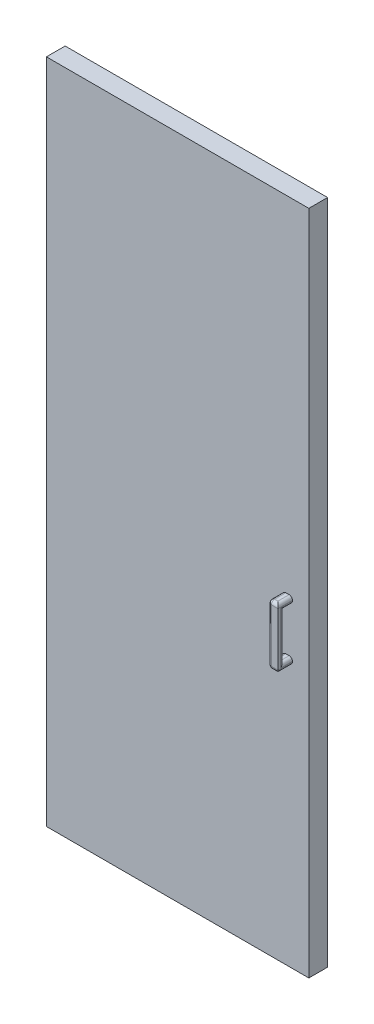
from build123d import *

# Parameters (mm, degrees)
BOSS_EXTRUDE2_DEPTH = 57.15
BOSS_EXTRUDE3_DEPTH = 44
CUT_EXTRUDE1_DEPTH  = 44
FILLET1_R           = 10
SKETCH6_W           = 120
SKETCH6_H           = 460.0000000000001
BOSS_EXTRUDE4_DEPTH = 10


with BuildPart() as part:
    # Sketch1 → Boss-Extrude2 (new body)
    with BuildSketch(Plane.XY):
        Polygon((0, 0), (0, 446.2018372120283), (-800, 446.2018372120282), (-799.9999999999998, -1585.7981627879717), (0, -1585.7981627879717), align=None)
    extrude(amount=BOSS_EXTRUDE2_DEPTH)

    # Sketch4 → Boss-Extrude3 (add)
    with BuildSketch(Plane.XY.offset(57.15)):
        Polygon((-79.99999999999993, -603.7981627879718), (-49.999999999999936, -603.7981627879718), (-49.999999999999915, -785.7981627879718), (-79.9999999999999, -785.7981627879718), align=None)
    extrude(amount=BOSS_EXTRUDE3_DEPTH)

    # Sketch5 → Cut-Extrude1 (cut)
    with BuildSketch(Plane.ZY.offset(80.00000000000003)):
        Polygon((83.14999999999999, -624.7981627879717), (57.150000000000006, -624.7981627879717), (57.15, -764.7981627879717), (83.15, -764.7981627879717), align=None)
    extrude(amount=-CUT_EXTRUDE1_DEPTH, mode=Mode.SUBTRACT)

    # Fillet1
    # the kernel refuses this fillet: 10 mm, written as the material it takes off along each edge
    with BuildSketch(Plane(origin=(-69.99999999999993, -613.7981627879718, 91.15), x_dir=(-1, -1.6e-16, 0), z_dir=(0, 1, 0))) as fillet1_piece_1_section:
        Polygon((0, 0), (FILLET1_R, 0), (FILLET1_R, FILLET1_R), (0, FILLET1_R), align=None)
    fillet1_piece_1 = extrude(amount=FILLET1_R, mode=Mode.PRIVATE)
    fillet1_piece_1 = fillet1_piece_1 - Plane(origin=(-69.99999999999993, -613.7981627879718, 91.15), x_dir=(0.7071067811865475, 0, -0.7071067811865475), z_dir=(0, 1, 0)) * Sphere(FILLET1_R, mode=Mode.PRIVATE)
    add(fillet1_piece_1, mode=Mode.SUBTRACT)
    with BuildSketch(Plane(origin=(-69.9999999999999, -775.7981627879718, 91.15), x_dir=(0, 0, 1), z_dir=(-1, -1.6e-16, 0))) as fillet1_piece_2_section:
        Polygon((0, 0), (FILLET1_R, 0), (FILLET1_R, -FILLET1_R), (0, -FILLET1_R), align=None)
    fillet1_piece_2 = extrude(amount=FILLET1_R, mode=Mode.PRIVATE)
    fillet1_piece_2 = fillet1_piece_2 - Plane(origin=(-69.9999999999999, -775.7981627879718, 91.15), x_dir=(0, 0.7071067811865475, -0.7071067811865475), z_dir=(-1, -1.6e-16, 0)) * Sphere(FILLET1_R, mode=Mode.PRIVATE)
    add(fillet1_piece_2, mode=Mode.SUBTRACT)
    with BuildSketch(Plane(origin=(-49.999999999999915, -785.7981627879718, 57.15), x_dir=(-1, 0, 0), z_dir=(0, 0, 1))) as fillet1_piece_3:
        with BuildLine():
            CenterArc((FILLET1_R, -FILLET1_R), FILLET1_R, 90, 90)
            Line((0, -FILLET1_R), (0, 0))
            Line((0, 0), (FILLET1_R, 0))
        make_face()
    extrude(amount=69, mode=Mode.SUBTRACT)
    with BuildSketch(Plane(origin=(-49.999999999999936, -603.7981627879718, 57.15), x_dir=(0, -1, 0), z_dir=(0, 0, 1))) as fillet1_piece_4:
        with BuildLine():
            CenterArc((FILLET1_R, -FILLET1_R), FILLET1_R, 90, 90)
            Line((0, -FILLET1_R), (0, 0))
            Line((0, 0), (FILLET1_R, 0))
        make_face()
    extrude(amount=69, mode=Mode.SUBTRACT)
    with BuildSketch(Plane(origin=(-79.99999999999993, -603.7981627879718, 57.15), x_dir=(1, 0, 0), z_dir=(0, 0, 1))) as fillet1_piece_5:
        with BuildLine():
            CenterArc((FILLET1_R, -FILLET1_R), FILLET1_R, 90, 90)
            Line((0, -FILLET1_R), (0, 0))
            Line((0, 0), (FILLET1_R, 0))
        make_face()
    extrude(amount=34.00000000000001, mode=Mode.SUBTRACT)
    with BuildSketch(Plane(origin=(-79.9999999999999, -785.7981627879718, 57.15), x_dir=(1, 0, 0), z_dir=(0, 0, 1))) as fillet1_piece_6:
        with BuildLine():
            CenterArc((FILLET1_R, FILLET1_R), FILLET1_R, 180, 90)
            Line((0, FILLET1_R), (0, 0))
            Line((0, 0), (FILLET1_R, 0))
        make_face()
    extrude(amount=34.00000000000001, mode=Mode.SUBTRACT)
    with BuildSketch(Plane(origin=(-69.99999999999993, -603.7981627879718, 101.15), x_dir=(0, 0, -1), z_dir=(1, 0, 0))) as fillet1_piece_7:
        with BuildLine():
            CenterArc((FILLET1_R, -FILLET1_R), FILLET1_R, 90, 90)
            Line((0, -FILLET1_R), (0, 0))
            Line((0, 0), (FILLET1_R, 0))
        make_face()
    extrude(amount=44.99999999999999, mode=Mode.SUBTRACT)
    with BuildSketch(Plane(origin=(-79.9999999999999, -775.7981627879718, 101.15), x_dir=(0, 0, -1), z_dir=(-1.6e-16, 1, 0))) as fillet1_piece_8:
        with BuildLine():
            CenterArc((FILLET1_R, -FILLET1_R), FILLET1_R, 90, 90)
            Line((0, -FILLET1_R), (0, 0))
            Line((0, 0), (FILLET1_R, 0))
        make_face()
    extrude(amount=162, mode=Mode.SUBTRACT)
    with BuildSketch(Plane(origin=(-24.999999999999915, -785.7981627879718, 101.15), x_dir=(0, 0, -1), z_dir=(-1, 0, 0))) as fillet1_piece_9:
        with BuildLine():
            CenterArc((FILLET1_R, -FILLET1_R), FILLET1_R, 90, 90)
            Line((0, -FILLET1_R), (0, 0))
            Line((0, 0), (FILLET1_R, 0))
        make_face()
    extrude(amount=44.999999999999986, mode=Mode.SUBTRACT)
    with BuildSketch(Plane(origin=(-79.99999999999991, -764.7981627879717, 57.15000000000002), x_dir=(1.42e-15, -1, 0), z_dir=(0, 0, 1))) as fillet1_piece_10:
        with BuildLine():
            CenterArc((FILLET1_R, FILLET1_R), FILLET1_R, 180, 89.99999999999989)
            Line((1.421e-14, FILLET1_R), (0, 0))
            Line((0, 0), (FILLET1_R, 0))
        make_face()
    extrude(amount=25.999999999999986, mode=Mode.SUBTRACT)
    with BuildSketch(Plane(origin=(-79.99999999999993, -624.7981627879717, 83.14999999999999), x_dir=(0, 1, 0), z_dir=(0, 0, -1))) as fillet1_piece_11:
        with BuildLine():
            CenterArc((FILLET1_R, FILLET1_R), FILLET1_R, 180, 90)
            Line((0, FILLET1_R), (0, 0))
            Line((0, 0), (FILLET1_R, 0))
        make_face()
    extrude(amount=25.999999999999986, mode=Mode.SUBTRACT)
    with BuildSketch(Plane(origin=(-79.99999999999991, -764.7981627879717, 83.15), x_dir=(1.42e-15, 1e-16, 1), z_dir=(-1.5e-16, 1, -1e-16))) as fillet1_piece_12:
        with BuildLine():
            CenterArc((FILLET1_R, FILLET1_R), FILLET1_R, 180, 89.99999999999989)
            Line((1.421e-14, FILLET1_R), (0, 0))
            Line((0, 0), (FILLET1_R, 0))
        make_face()
    extrude(amount=140, mode=Mode.SUBTRACT)
    with BuildSketch(Plane(origin=(-49.999999999999915, -764.7981627879717, 83.15), x_dir=(0, -1, 0), z_dir=(0, 0, -1))) as fillet1_piece_13:
        with BuildLine():
            CenterArc((FILLET1_R, FILLET1_R), FILLET1_R, 180, 90)
            Line((0, FILLET1_R), (0, 0))
            Line((0, 0), (FILLET1_R, 0))
        make_face()
    extrude(amount=26, mode=Mode.SUBTRACT)
    with BuildSketch(Plane(origin=(-49.999999999999936, -624.7981627879717, 57.150000000000006), x_dir=(0, 1, 0), z_dir=(0, 0, 1))) as fillet1_piece_14:
        with BuildLine():
            CenterArc((FILLET1_R, FILLET1_R), FILLET1_R, 180.00000000000003, 90)
            Line((0, FILLET1_R), (0, 0))
            Line((0, 0), (FILLET1_R, 0))
        make_face()
    extrude(amount=25.999999999999986, mode=Mode.SUBTRACT)
    with BuildSketch(Plane(origin=(-49.999999999999936, -624.7981627879717, 83.15), x_dir=(0, 1e-16, 1), z_dir=(1.2e-16, -1, 1e-16))) as fillet1_piece_15:
        with BuildLine():
            CenterArc((FILLET1_R, FILLET1_R), FILLET1_R, 180, 90)
            Line((0, FILLET1_R), (0, 0))
            Line((0, 0), (FILLET1_R, 0))
        make_face()
    extrude(amount=140, mode=Mode.SUBTRACT)
    with BuildSketch(Plane(origin=(-79.99999999999991, -764.7981627879717, 57.15000000000002), x_dir=(1.42e-15, -1, 0), z_dir=(0, 0, 1))) as fillet1_piece_16a_section:
        with BuildLine():
            CenterArc((FILLET1_R, FILLET1_R), FILLET1_R, 180, 89.99999999999989)
            Line((1.421e-14, FILLET1_R), (0, 0))
            Line((0, 0), (FILLET1_R, 0))
        make_face()
    fillet1_piece_16a = extrude(amount=50.999999999999986, mode=Mode.PRIVATE)
    fillet1_piece_16a = split(fillet1_piece_16a, bisect_by=Plane(origin=(-77.7360488573316, -767.0621139306398, 83.15), z_dir=(0, 1e-16, 1)), keep=Keep.TOP, mode=Mode.PRIVATE)
    with BuildSketch(Plane(origin=(-79.9999999999999, -789.7981627879717, 83.15), x_dir=(0, 1e-16, 1), z_dir=(-1.5e-16, 1, -1e-16))) as fillet1_piece_16b_section:
        with BuildLine():
            CenterArc((FILLET1_R, FILLET1_R), FILLET1_R, 180, 90)
            Line((0, FILLET1_R), (0, 0))
            Line((0, 0), (FILLET1_R, 0))
        make_face()
    fillet1_piece_16b = extrude(amount=165, mode=Mode.PRIVATE)
    fillet1_piece_16b = split(fillet1_piece_16b, bisect_by=Plane(origin=(-77.73604885733165, -764.7981627879717, 85.41395114266827), z_dir=(1.5e-16, -1, 0)), keep=Keep.TOP, mode=Mode.PRIVATE)
    fillet1_piece_16 = fillet1_piece_16a & fillet1_piece_16b
    add(fillet1_piece_16, mode=Mode.SUBTRACT)
    with BuildSketch(Plane(origin=(-79.99999999999991, -764.7981627879717, 83.15), x_dir=(1.42e-15, 1e-16, 1), z_dir=(-1.5e-16, 1, -1e-16))) as fillet1_piece_17a_section:
        with BuildLine():
            CenterArc((FILLET1_R, FILLET1_R), FILLET1_R, 180, 89.99999999999989)
            Line((1.421e-14, FILLET1_R), (0, 0))
            Line((0, 0), (FILLET1_R, 0))
        make_face()
    fillet1_piece_17a = extrude(amount=165, mode=Mode.PRIVATE)
    fillet1_piece_17a = split(fillet1_piece_17a, bisect_by=Plane(origin=(-77.73604885733167, -624.7981627879717, 85.41395114266825), z_dir=(-1.5e-16, 1, 0)), keep=Keep.TOP, mode=Mode.PRIVATE)
    with BuildSketch(Plane(origin=(-79.99999999999993, -624.7981627879717, 108.14999999999998), x_dir=(0, 1, 0), z_dir=(0, 0, -1))) as fillet1_piece_17b_section:
        with BuildLine():
            CenterArc((FILLET1_R, FILLET1_R), FILLET1_R, 180, 90)
            Line((0, FILLET1_R), (0, 0))
            Line((0, 0), (FILLET1_R, 0))
        make_face()
    fillet1_piece_17b = extrude(amount=50.999999999999986, mode=Mode.PRIVATE)
    fillet1_piece_17b = split(fillet1_piece_17b, bisect_by=Plane(origin=(-77.73604885733164, -622.5342116453035, 83.14999999999999), z_dir=(0, 1e-16, 1)), keep=Keep.TOP, mode=Mode.PRIVATE)
    fillet1_piece_17 = fillet1_piece_17a & fillet1_piece_17b
    add(fillet1_piece_17, mode=Mode.SUBTRACT)
    with BuildSketch(Plane(origin=(-49.999999999999936, -624.7981627879717, 83.15), x_dir=(0, 1e-16, 1), z_dir=(1.2e-16, -1, 1e-16))) as fillet1_piece_18a_section:
        with BuildLine():
            CenterArc((FILLET1_R, FILLET1_R), FILLET1_R, 180, 90)
            Line((0, FILLET1_R), (0, 0))
            Line((0, 0), (FILLET1_R, 0))
        make_face()
    fillet1_piece_18a = extrude(amount=165, mode=Mode.PRIVATE)
    fillet1_piece_18a = split(fillet1_piece_18a, bisect_by=Plane(origin=(-52.26395114266817, -764.7981627879717, 85.41395114266827), z_dir=(1.5e-16, -1, 0)), keep=Keep.TOP, mode=Mode.PRIVATE)
    with BuildSketch(Plane(origin=(-49.999999999999915, -764.7981627879717, 108.15), x_dir=(0, -1, 0), z_dir=(0, 0, -1))) as fillet1_piece_18b_section:
        with BuildLine():
            CenterArc((FILLET1_R, FILLET1_R), FILLET1_R, 180, 90)
            Line((0, FILLET1_R), (0, 0))
            Line((0, 0), (FILLET1_R, 0))
        make_face()
    fillet1_piece_18b = extrude(amount=51, mode=Mode.PRIVATE)
    fillet1_piece_18b = split(fillet1_piece_18b, bisect_by=Plane(origin=(-52.2639511426682, -767.0621139306397, 83.15), z_dir=(0, 1e-16, 1)), keep=Keep.TOP, mode=Mode.PRIVATE)
    fillet1_piece_18 = fillet1_piece_18a & fillet1_piece_18b
    add(fillet1_piece_18, mode=Mode.SUBTRACT)
    with BuildSketch(Plane(origin=(-49.999999999999936, -624.7981627879717, 57.150000000000006), x_dir=(0, 1, 0), z_dir=(0, 0, 1))) as fillet1_piece_19a_section:
        with BuildLine():
            CenterArc((FILLET1_R, FILLET1_R), FILLET1_R, 180.00000000000003, 90)
            Line((0, FILLET1_R), (0, 0))
            Line((0, 0), (FILLET1_R, 0))
        make_face()
    fillet1_piece_19a = extrude(amount=50.999999999999986, mode=Mode.PRIVATE)
    fillet1_piece_19a = split(fillet1_piece_19a, bisect_by=Plane(origin=(-52.26395114266823, -622.5342116453035, 83.14999999999999), z_dir=(0, 1e-16, 1)), keep=Keep.TOP, mode=Mode.PRIVATE)
    with BuildSketch(Plane(origin=(-49.999999999999936, -599.7981627879717, 83.14999999999999), x_dir=(0, 1e-16, 1), z_dir=(1.2e-16, -1, 1e-16))) as fillet1_piece_19b_section:
        with BuildLine():
            CenterArc((FILLET1_R, FILLET1_R), FILLET1_R, 179.99999999999997, 90)
            Line((0, FILLET1_R), (0, 0))
            Line((0, 0), (FILLET1_R, 0))
        make_face()
    fillet1_piece_19b = extrude(amount=165, mode=Mode.PRIVATE)
    fillet1_piece_19b = split(fillet1_piece_19b, bisect_by=Plane(origin=(-52.26395114266818, -624.7981627879717, 85.41395114266824), z_dir=(-1.5e-16, 1, 0)), keep=Keep.TOP, mode=Mode.PRIVATE)
    fillet1_piece_19 = fillet1_piece_19a & fillet1_piece_19b
    add(fillet1_piece_19, mode=Mode.SUBTRACT)

    # Sketch6 → Boss-Extrude4 (add)
    with BuildSketch(Plane(origin=(0, 0, 0), x_dir=(-1, 0, 0), z_dir=(0, 0, -1))):
        with Locations((85, -694.7981627879719)):
            Rectangle(SKETCH6_W, SKETCH6_H)
    extrude(amount=BOSS_EXTRUDE4_DEPTH)


solid = part.part
